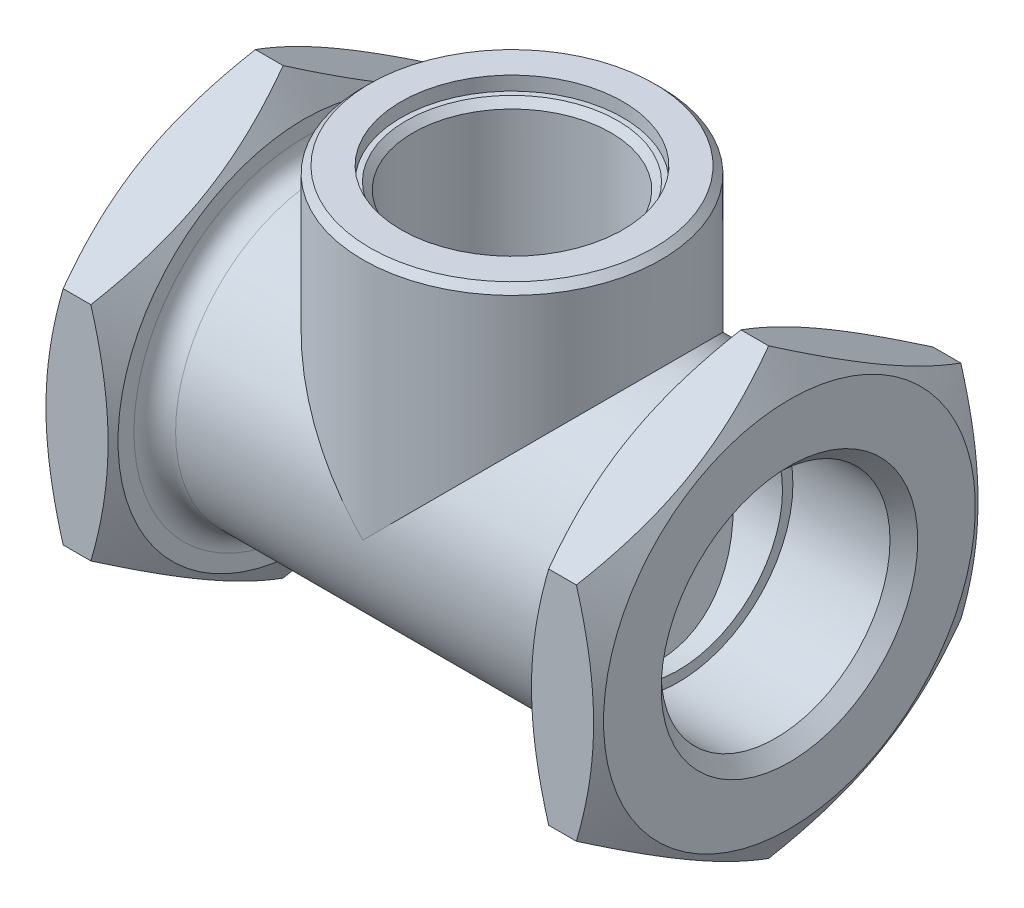
from build123d import *
from build123d.topology import SkipClean

# Parameters (mm, degrees)
BOSS_EXTRUDE1_DEPTH      = 10
SKETCH2_R                = 21.5
SKETCH2_R_2              = 15
BOSS_EXTRUDE2_DEPTH      = 60
BOSS_EXTRUDE3_DEPTH      = 10
BOSS_EXTRUDE4_REACH      = 110.591
BOSS_EXTRUDE4_END_RADIUS = 21.5
SKETCH5_R                = 21.5
FILLET1_R                = 3
SKETCH7_R                = 15
CUT_EXTRUDE1_DEPTH       = 93
SKETCH8_R                = 16
CUT_EXTRUDE2_DEPTH       = 2
SKETCH9_R                = 14.25
CUT_EXTRUDE3_DEPTH       = 31
SKETCH10_W               = 30
SKETCH10_H               = 35
BOSS_EXTRUDE5_DEPTH      = 2.5
SKETCH11_R               = 10
CUT_EXTRUDE4_DEPTH       = 5
BOSS_EXTRUDE6_DEPTH      = 15
FILLET2_R                = 3
BOSS_EXTRUDE7_DEPTH      = 20
SKETCH14_R               = 16.5
CUT_EXTRUDE5_DEPTH       = 16
CUT_EXTRUDE6_START       = -16
SKETCH15_R               = 16.5
CUT_EXTRUDE6_DEPTH       = 16
CHAMFER1_SIZE            = 2
CHAMFER3_SIZE            = 1


with BuildPart() as part:
    # Sketch1 → Boss-Extrude1 (new body)
    with BuildSketch(Plane(origin=(0, 0, 0), x_dir=(0, 0, -1), z_dir=(1, 0, 0))):
        Polygon((0, 32), (-27.712812921, 16), (-27.712812921, -16), (0, -32), (27.712812921, -16), (27.712812921, 16), align=None)
    extrude(amount=-BOSS_EXTRUDE1_DEPTH)

    # Sketch2 → Boss-Extrude2 (add)
    with BuildSketch(Plane.ZY.offset(10)):
        Circle(SKETCH2_R)
        Circle(SKETCH2_R_2, mode=Mode.SUBTRACT)
    extrude(amount=BOSS_EXTRUDE2_DEPTH)

    # Sketch3 → Boss-Extrude3 (add)
    with BuildSketch(Plane.ZY.offset(70)):
        Polygon((27.712812921, 16), (0, 32), (-27.712812921, 16), (-27.712812921, -16), (0, -32), (27.712812921, -16), align=None)
    extrude(amount=BOSS_EXTRUDE3_DEPTH)

    # Boss-Extrude4: up to this cylinder (the profile starts outside it)
    boss_extrude4_end = Plane(origin=(-40, 0, 0), z_dir=(1, 0, 0)) * Cylinder(BOSS_EXTRUDE4_END_RADIUS, 265.182, mode=Mode.PRIVATE)
    # Sketch5 → Boss-Extrude4 (add, up to the surface)
    with BuildSketch(Plane(origin=(0, 36, 0), x_dir=(1, 0, 0), z_dir=(0, 1, 0)), mode=Mode.PRIVATE) as boss_extrude4_sk1:
        with Locations((-40, 0)):
            Circle(SKETCH5_R)
    boss_extrude4_tool1 = extrude(boss_extrude4_sk1.sketch, amount=-BOSS_EXTRUDE4_REACH, mode=Mode.PRIVATE) - boss_extrude4_end
    add(boss_extrude4_tool1.solids().sort_by_distance((-40, 36, 0))[0])

    # Sketch6 → Cut-Revolve1 (revolve, cut)
    with BuildSketch(Plane.XY):
        Polygon((0, 26.803847577), (0, 32), (-3, 32), align=None)
        Polygon((-10, 26.803847577), (-10, 32), (-7, 32), align=None)
        Polygon((-73, 32), (-70, 26.803847577), (-70, 32), align=None)
        Polygon((-77, 32), (-80, 26.803847577), (-80, 32), align=None)
    revolve(axis=Axis((-80, 0, 0), (1, 0, 0)), mode=Mode.SUBTRACT)

    # Fillet1
    fillet1_edges = [part.edges().sort_by_distance(p)[0] for p in [
        (-10, 0, -21.5),
        (-70, 0, -21.5),
    ]]
    fillet(fillet1_edges, radius=FILLET1_R)

    # Sketch7 → Cut-Extrude1 (cut, through all)
    with BuildSketch(Plane(origin=(0, 0, 0), x_dir=(0, 0, -1), z_dir=(1, 0, 0))):
        Circle(SKETCH7_R)
    extrude(amount=-CUT_EXTRUDE1_DEPTH, mode=Mode.SUBTRACT)

    # Sketch8 → Cut-Extrude2 (cut)
    with BuildSketch(Plane(origin=(0, 36, 0), x_dir=(1, 0, 0), z_dir=(0, 1, 0))):
        with Locations((-40, 0)):
            Circle(SKETCH8_R)
    extrude(amount=-CUT_EXTRUDE2_DEPTH, mode=Mode.SUBTRACT)

    # Sketch9 → Cut-Extrude3 (cut)
    with BuildSketch(Plane(origin=(0, 34, 0), x_dir=(1, 0, 0), z_dir=(0, 1, 0))):
        with Locations((-40, 0)):
            Circle(SKETCH9_R)
    extrude(amount=-CUT_EXTRUDE3_DEPTH, mode=Mode.SUBTRACT)

    # Sketch10 → Boss-Extrude5 (add, symmetric)
    with SkipClean():  # the faces are left unmerged after this step: merging them gives an invalid solid
        with BuildSketch(Plane(origin=(0, 0, 0), x_dir=(1, 0, 0), z_dir=(0, 1, 0))):
            with Locations((-40, 0)):
                Rectangle(SKETCH10_W, SKETCH10_H)
        extrude(amount=BOSS_EXTRUDE5_DEPTH, both=True)
    add(part.part.scale(1), mode=Mode.REPLACE)  # the faces are merged on a copy

    # Sketch11 → Cut-Extrude4 (cut)
    with BuildSketch(Plane(origin=(0, 2.5, 0), x_dir=(1, 0, 0), z_dir=(0, 1, 0))):
        with Locations((-40, 0)):
            Circle(SKETCH11_R)
    extrude(amount=-CUT_EXTRUDE4_DEPTH, mode=Mode.SUBTRACT)

    # Sketch12 → Boss-Extrude6 (add, symmetric)
    with BuildSketch(Plane.XY):
        Polygon((-28.180148829, -2.5), (-23.6305209, -15), (-18.6305209, -15), (-25, 2.5), align=None)
    extrude(amount=BOSS_EXTRUDE6_DEPTH, both=True)

    # Fillet2
    fillet2_edges = [part.edges().sort_by_distance(p)[0] for p in [
        (-28.180148829, -2.5, 0),
        (-25, 2.5, 0),
    ]]
    fillet(fillet2_edges, radius=FILLET2_R)

    # Sketch13 → Boss-Extrude7 (add)
    with SkipClean():  # the faces are left unmerged after this step: merging them gives an invalid solid
        with BuildSketch(Plane.XZ.offset(2.5)):
            with BuildLine():
                Line((-40, 21), (-40, 15))
                ThreePointArc((-40, 15), (-55, 0), (-40, -15))
                Line((-40, -15), (-40, -21))
                ThreePointArc((-40, -21), (-61, 0), (-40, 21))
            make_face()
        extrude(amount=-BOSS_EXTRUDE7_DEPTH)

    # Sketch14 → Cut-Extrude5 (cut)
    with BuildSketch(Plane(origin=(0, 0, 0), x_dir=(0, 0, -1), z_dir=(1, 0, 0))):
        Circle(SKETCH14_R)
    extrude(amount=-CUT_EXTRUDE5_DEPTH, mode=Mode.SUBTRACT)

    # Sketch15 → Cut-Extrude6 (cut)
    with BuildSketch(Plane.ZY.offset(80).offset(CUT_EXTRUDE6_START)):
        Circle(SKETCH15_R)
    extrude(amount=CUT_EXTRUDE6_DEPTH, mode=Mode.SUBTRACT)

    # Chamfer1
    chamfer1_edges = [part.edges().sort_by_distance(p)[0] for p in [
        (0, 0, 16.5),
        (-80, 0, -16.5),
    ]]
    chamfer(chamfer1_edges, length=CHAMFER1_SIZE)

    # Chamfer3
    chamfer3_edges = [part.edges().sort_by_distance(p)[0] for p in [
        (-54.25, 34, 0),
        (-61.5, 36, 0),
    ]]
    chamfer(chamfer3_edges, length=CHAMFER3_SIZE)


solid = part.part
